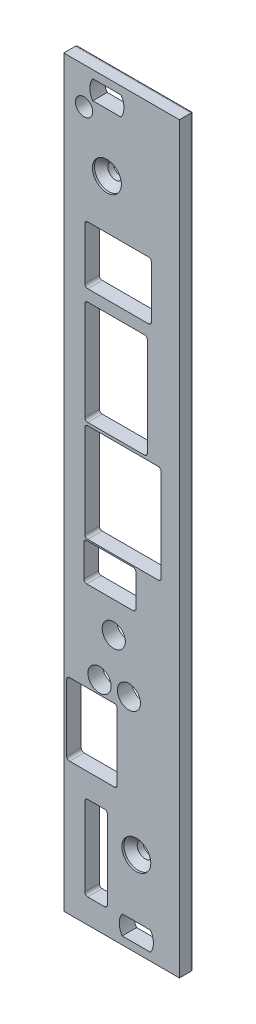
from build123d import *

# Parameters (mm, degrees)
SKETCH1_W                                      = 19.98
SKETCH1_H                                      = 128.4
BOSS_EXTRUDE1_DEPTH                            = 2.5
CUT_EXTRUDE1_DEPTH                             = 127.049239982
CUT_EXTRUDE2_DEPTH                             = 127.049239982
SKETCH4_W                                      = 3.9
SKETCH4_H                                      = 14.6
CUT_EXTRUDE3_DEPTH                             = 127.049239982
F_3_0_3_DIAMETER_HOLE1_D                       = 3
CSK_FOR_M2_5_FLAT_HEAD_MACHINE_SCREW1_AT_COUNT = 2
CSK_FOR_M2_5_FLAT_HEAD_MACHINE_SCREW1_AT_PITCH = 99.130249672
USB_DEPTH                                      = 127.049239982
SKETCH10_R                                     = 2
LEDS_DEPTH                                     = 127.049239982
SKETCH11_R                                     = 2
SINGLE_LED_DEPTH                               = 127.049239982
SKETCH13_W                                     = 9
SKETCH13_H                                     = 6.5
DISABLE_COMMS_DEPTH                            = 127.049239982
SKETCH14_W                                     = 13.2
SKETCH14_H                                     = 17
RJ45_DEPTH                                     = 127.049239982
SKETCH15_W                                     = 10.8
SKETCH15_H                                     = 18
OUTPUT_DEPTH                                   = 127.049239982
SKETCH16_W                                     = 11.5
SKETCH16_H                                     = 10
POWER_DEPTH                                    = 127.049239982
FILLETS_R                                      = 0.5
FILLET2_R                                      = 0.5


with BuildPart() as part:
    # Sketch1 → Boss-Extrude1 (new body)
    with BuildSketch(Plane.XY.offset(2.5)):
        with Locations((2.54, 61.2)):
            Rectangle(SKETCH1_W, SKETCH1_H)
    extrude(amount=-BOSS_EXTRUDE1_DEPTH)

    # Sketch2 → Cut-Extrude1 (cut, through all)
    with BuildSketch(Plane.XY.offset(2.5)):
        with BuildLine():
            Line((2.445403852, 124.05), (-2.445403852, 124.05))
            ThreePointArc((-2.445403852, 124.05), (-2.95, 122.4), (-2.445403852, 120.75))
            Line((-2.445403852, 120.75), (2.445403852, 120.75))
            ThreePointArc((2.445403852, 120.75), (2.95, 122.4), (2.445403852, 124.05))
        make_face()
    extrude(amount=-CUT_EXTRUDE1_DEPTH, mode=Mode.SUBTRACT)

    # Sketch3 → Cut-Extrude2 (cut, through all)
    with BuildSketch(Plane.XY.offset(2.5)):
        with BuildLine():
            Line((7.525403852, 1.65), (2.634596148, 1.65))
            ThreePointArc((2.634596148, 1.65), (2.13, 0), (2.634596148, -1.65))
            Line((2.634596148, -1.65), (7.525403852, -1.65))
            ThreePointArc((7.525403852, -1.65), (8.03, 0), (7.525403852, 1.65))
        make_face()
    extrude(amount=-CUT_EXTRUDE2_DEPTH, mode=Mode.SUBTRACT)

    # Sketch4 → Cut-Extrude3 (cut, through all)
    with BuildSketch(Plane(origin=(0, 0, 0), x_dir=(-1, 0, 0), z_dir=(0, 0, -1))):
        with Locations((1.87, 8.5)):
            Rectangle(SKETCH4_W, SKETCH4_H)
    extrude(amount=-CUT_EXTRUDE3_DEPTH, mode=Mode.SUBTRACT)

    # Ø3.0 (3) Diameter Hole1 (through all)
    with Locations(Plane.XY.offset(2.5)):
        with Locations((-3.95, 119.1)):
            Hole(F_3_0_3_DIAMETER_HOLE1_D / 2)

    # Sketch7 → CSK for M2.5 Flat Head Machine Screw1 (revolve, cut)
    with BuildSketch(Plane(origin=(5.08, 11.7, 2.5), x_dir=(0, -1, 0), z_dir=(1, 0, 0))):
        Polygon((0, 0), (0, 2.5), (1.35, 2.5), (1.35, 1.5), (2.5, 0.35), (2.5, 0), align=None)
    csk_for_m2_5_flat_head_machine_screw1 = revolve(axis=Axis((5.08, 11.7, 8.85), (0, 0, -1)), mode=Mode.SUBTRACT)

    # CSK for M2.5 Flat Head Machine Screw1 at: CSK for M2.5 Flat Head Machine Screw1 ×2
    with Locations(*[Vector(-0.05124570972853528, 0.9986860754183062, 0) * (i * CSK_FOR_M2_5_FLAT_HEAD_MACHINE_SCREW1_AT_PITCH) for i in range(1, CSK_FOR_M2_5_FLAT_HEAD_MACHINE_SCREW1_AT_COUNT)]):
        add(csk_for_m2_5_flat_head_machine_screw1, mode=Mode.SUBTRACT)

    # Sketch9 → USB (cut, through all)
    with BuildSketch(Plane.XY.offset(2.5)):
        Polygon((-3.82, 19.95), (1.78, 19.95), (1.78, 32.45), (-3.82, 32.45), (-6.95, 32.45), (-6.95, 19.95), align=None)
    extrude(amount=-USB_DEPTH, mode=Mode.SUBTRACT)

    # Sketch10 → LEDs (cut, through all)
    with BuildSketch(Plane.XY.offset(2.5)):
        with Locations((-1.28, 34.72)):
            Circle(SKETCH10_R)
        with Locations((3.8, 34.72)):
            Circle(SKETCH10_R)
    extrude(amount=-LEDS_DEPTH, mode=Mode.SUBTRACT)

    # Sketch11 → Single LED (cut, through all)
    with BuildSketch(Plane.XY.offset(2.5)):
        with Locations((1.18, 42.62)):
            Circle(SKETCH11_R)
    extrude(amount=-SINGLE_LED_DEPTH, mode=Mode.SUBTRACT)

    # Sketch13 → Disable comms (cut, through all)
    with BuildSketch(Plane.XY.offset(2.5)):
        with Locations((0.505, 51.2)):
            Rectangle(SKETCH13_W, SKETCH13_H)
    extrude(amount=-DISABLE_COMMS_DEPTH, mode=Mode.SUBTRACT)

    # Sketch14 → RJ45 (cut, through all)
    with BuildSketch(Plane.XY.offset(2.5)):
        with Locations((2.78, 63.2)):
            Rectangle(SKETCH14_W, SKETCH14_H)
    extrude(amount=-RJ45_DEPTH, mode=Mode.SUBTRACT)

    # Sketch15 → Output (cut, through all)
    with BuildSketch(Plane.XY.offset(2.5)):
        with Locations((1.58, 81.2)):
            Rectangle(SKETCH15_W, SKETCH15_H)
    extrude(amount=-OUTPUT_DEPTH, mode=Mode.SUBTRACT)

    # Sketch16 → Power (cut, through all)
    with BuildSketch(Plane.XY.offset(2.5)):
        with Locations((1.93, 97.2)):
            Rectangle(SKETCH16_W, SKETCH16_H)
    extrude(amount=-POWER_DEPTH, mode=Mode.SUBTRACT)

    # Fillets
    fillets_edges = [part.edges().sort_by_distance(p)[0] for p in [
        (5.005, 54.45, 1.25),
        (5.005, 47.95, 1.25),
        (-3.995, 47.95, 1.25),
        (-3.995, 54.45, 1.25),
        (9.38, 54.7, 1.25),
        (-3.82, 54.7, 1.25),
        (-3.82, 71.7, 1.25),
        (9.38, 71.7, 1.25),
        (6.98, 72.2, 1.25),
        (-3.82, 72.2, 1.25),
        (-3.82, 90.2, 1.25),
        (6.98, 90.2, 1.25),
        (7.68, 92.2, 1.25),
        (-3.82, 92.2, 1.25),
        (-3.82, 102.2, 1.25),
        (7.68, 102.2, 1.25),
        (-3.82, 15.8, 1.25),
        (-3.82, 1.2, 1.25),
        (0.08, 1.2, 1.25),
        (0.08, 15.8, 1.25),
        (-6.95, 19.95, 1.25),
        (-6.95, 32.45, 1.25),
        (1.78, 32.45, 1.25),
        (1.78, 19.95, 1.25),
    ]]
    fillet(fillets_edges, radius=FILLETS_R)

    # Fillet2
    fillet2_edges = [part.edges().sort_by_distance(p)[0] for p in [
        (-7.45, 61.2, 0),
        (2.54, -3, 0),
        (12.53, 61.2, 0),
        (2.54, 125.4, 0),
    ]]
    fillet(fillet2_edges, radius=FILLET2_R - 0.0001)  # a hair under: the kernel refuses the full size


solid = part.part
